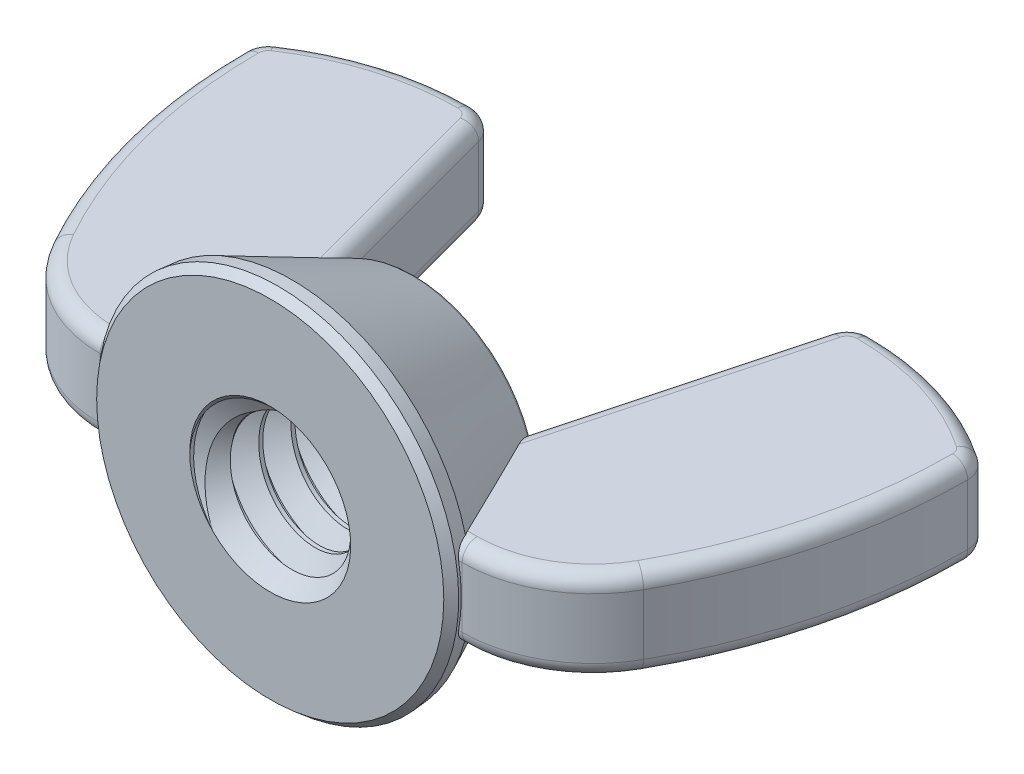
from build123d import *

# Parameters (mm, degrees)
EXTRUDE2_DEPTH     = 1.7859375
SKETCH3_R          = 7.14375
EXTRUDE1_DEPTH     = 0.85725
EXTRUDE1_DRAFT     = -5
SKETCH15_R         = 7.068750343
EXTRUDE3_DEPTH     = 4.85775
EXTRUDE3_TAPER     = 25.010716405
FILLET3_R          = 0.254
SKETCH4_R          = 3.175
CUT_EXTRUDE1_DEPTH = 23.520689273
SWEEP1_PITCH       = 1.27
SKETCH7_R          = 7.14375
CUT_EXTRUDE2_DEPTH = 23.520689304
SKETCH8_R          = 7.068750343
CUT_EXTRUDE3_DEPTH = 19.931228744
SKETCH11_R         = 3.1242
CUT_EXTRUDE5_DEPTH = 19.931228706
CUT_EXTRUDE5_TAPER = 45
CHAMFER1_SIZE      = 0.32146875
CHAMFER1_SIZE2     = 0.296735699
FILLET4_R          = 0.5953125


with BuildPart() as part:
    # Sketch13 → Extrude2 (new, symmetric)
    with BuildSketch(Plane(origin=(0, 0, 0), x_dir=(1, 0, 0), z_dir=(0, 1, 0))):
        with BuildLine():
            Line((4.389693963, 0.428625), (7.14375, 0.428625))
            ThreePointArc((7.14375, 0.428625), (9.756981768, 1.139436694), (11.650114359, 3.076001314))
            ThreePointArc((11.650114359, 3.076001314), (13.617383115, 7.982042394), (14.2875, 13.225164441))
            ThreePointArc((14.2875, 13.225164441), (14.171362065, 13.690968257), (13.850136709, 14.047725157))
            ThreePointArc((13.850136709, 14.047725157), (10.998307384, 15.407977968), (7.873390004, 15.875))
            ThreePointArc((7.873390004, 15.875), (7.269384524, 15.669967767), (6.915010473, 15.139609521))
            Line((6.915010473, 15.139609521), (4.389693963, 5.715))
            Line((4.389693963, 5.715), (4.389693963, 0.428625))
        make_face()
    extrude(amount=EXTRUDE2_DEPTH, both=True)

    # Fillet4
    fillet4_edges = [part.edges().sort_by_distance(p)[0] for p in [
        (9.756981768, 1.7859375, -1.139436694),
        (5.766721982, -1.7859375, -0.428625),
        (13.617383115, 1.7859375, -7.982042394),
        (14.171362065, 1.7859375, -13.690968257),
        (10.998307384, 1.7859375, -15.407977968),
        (7.269384524, 1.7859375, -15.669967767),
        (5.652352218, 1.7859375, -10.427304761),
        (5.766721982, 1.7859375, -0.428625),
        (5.652352218, -1.7859375, -10.427304761),
        (7.269384524, -1.7859375, -15.669967767),
        (10.998307384, -1.7859375, -15.407977968),
        (14.171362065, -1.7859375, -13.690968257),
        (13.617383115, -1.7859375, -7.982042394),
        (9.756981768, -1.7859375, -1.139436694),
    ]]
    fillet(fillet4_edges, radius=FILLET4_R)


with BuildPart() as body_2:
    # Sketch3 → Extrude1 (with draft: the straight prism first)
    with BuildSketch(Plane.XY):
        Circle(SKETCH3_R)
    extrude(amount=-EXTRUDE1_DEPTH)
    # Extrude1: the draft: its side faces are tilted about the plane it starts from
    extrude1_sides = [body_2.faces().sort_by_distance(p)[0] for p in [
        (-7.14375, 0, -0.428625),
    ]]
    draft(extrude1_sides, Plane.XY, EXTRUDE1_DRAFT)

    # Sketch15 → Extrude3 (add)
    with BuildSketch(Plane(origin=(0, 0, -0.85725), x_dir=(-1, 0, 0), z_dir=(0, 0, -1))):
        Circle(SKETCH15_R)
    extrude(amount=EXTRUDE3_DEPTH, taper=EXTRUDE3_TAPER)

    # Fillet3
    fillet3_edges = [body_2.edges().sort_by_distance(p)[0] for p in [
        (4.80243808, 0, -5.715),
    ]]
    fillet(fillet3_edges, radius=FILLET3_R)

    # Sketch4 → Cut-Extrude1 (cut, through all)
    with BuildSketch(Plane.XY):
        Circle(SKETCH4_R)
    extrude(amount=-CUT_EXTRUDE1_DEPTH, mode=Mode.SUBTRACT)

    # Sweep1: the profile of Sketch6 profile screwed along a right-hand helix of 7 turns, 6 arcs to a turn; built about Z, then put on its axis
    sweep1_z = Axis((0, 0, 0), (0, 0, 1))
    sweep1_corners = [(3.1753, 0, -1.111423205), (2.350110803, 0, -0.635), (2.350110803, 0, -0.47625), (3.1753, 0, 0.000173205)]
    with BuildLine(mode=Mode.PRIVATE) as sweep1_profile:
        Line(sweep1_corners[0], sweep1_corners[1])
        Line(sweep1_corners[1], sweep1_corners[2])
        Line(sweep1_corners[2], sweep1_corners[3])
        Line(sweep1_corners[3], sweep1_corners[0])
    sweep1_cap = Face(sweep1_profile.wire())
    sweep1_turn_angles = [0, 30, 60, 90, 120, 150, 180, 210, 240, 270, 300, 330, 360]
    sweep1_turn_weights = [1, 0.8660254037844387, 1, 0.8660254037844387, 1, 0.8660254037844387, 1, 0.8660254037844387, 1, 0.8660254037844387, 1, 0.8660254037844387, 1]
    sweep1_turn_rails = [Edge.make_bspline([Vector(p[0], p[1], 0).rotate(sweep1_z, sweep1_turn_angles[k]) / sweep1_turn_weights[k] + Vector(0, 0, p[2] + SWEEP1_PITCH * sweep1_turn_angles[k] / 360) for k in range(13)], [0, 0, 0, 1, 1, 2, 2, 3, 3, 4, 4, 5, 5, 6, 6, 6], 2, sweep1_turn_weights) for p in sweep1_corners]
    sweep1_turn_sides = [Face.make_surface_from_curves(sweep1_turn_rails[p[0]], sweep1_turn_rails[p[1]]) for p in [(0, 1), (1, 2), (2, 3), (3, 0)]]
    sweep1 = Plane(origin=(0, 0, 0), x_dir=(-1, 0, 0), z_dir=(0, 0, -1)) * Solid(Shell([*[p.moved(Location((0, 0, SWEEP1_PITCH * i))) for i in range(7) for p in sweep1_turn_sides], sweep1_cap, sweep1_cap.rotate(sweep1_z, 2520).moved(Location((0, 0, SWEEP1_PITCH * 2520 / 360)))]))
    add(sweep1)

    # Sketch7 → Cut-Extrude2 (cut, through all)
    with BuildSketch(Plane.XY):
        Circle(SKETCH7_R)
    extrude(amount=CUT_EXTRUDE2_DEPTH, mode=Mode.SUBTRACT)

    # Sketch8 → Cut-Extrude3 (cut, through all)
    with BuildSketch(Plane.XY.offset(-5.715)):
        Circle(SKETCH8_R)
    extrude(amount=-CUT_EXTRUDE3_DEPTH, mode=Mode.SUBTRACT)

    # Cut-Extrude4 cone 1 section (through the dimple's axis) → Cut-Extrude4 (revolve, cut)
    with BuildSketch(Plane(origin=(0, 0, 0), x_dir=(0, -1, 0), z_dir=(1, 0, 0))):
        Polygon((0, 0), (3.175, 0), (0, 3.175), align=None)
    revolve(axis=Axis((0, 0, 0), (0, 0, -1)), mode=Mode.SUBTRACT)

    # Sketch11 → Cut-Extrude5 (cut, through all)
    with BuildSketch(Plane.XY.offset(-5.715)):
        Circle(SKETCH11_R)
    extrude(amount=CUT_EXTRUDE5_DEPTH, taper=CUT_EXTRUDE5_TAPER, mode=Mode.SUBTRACT)

    # Chamfer1
    chamfer1_edges = [body_2.edges().sort_by_distance(p)[0] for p in [
        (-7.14375, 0, 0),
    ]]
    chamfer1_side = [body_2.faces().sort_by_distance(p)[0] for p in [
        (-7.106250172, 0, -0.428625),
    ]]
    chamfer(chamfer1_edges, length=CHAMFER1_SIZE, length2=CHAMFER1_SIZE2, reference=chamfer1_side[0])


with BuildPart() as body_3:
    # Mirror6: mirrored copy
    add(part.part.mirror(Plane(origin=(0, 0, 0), x_dir=(0, 0, 1), z_dir=(1, 0, 0))))

    # Combine2: union part, body 2
    add(part.part)
    add(body_2.part)


solid = body_3.part
